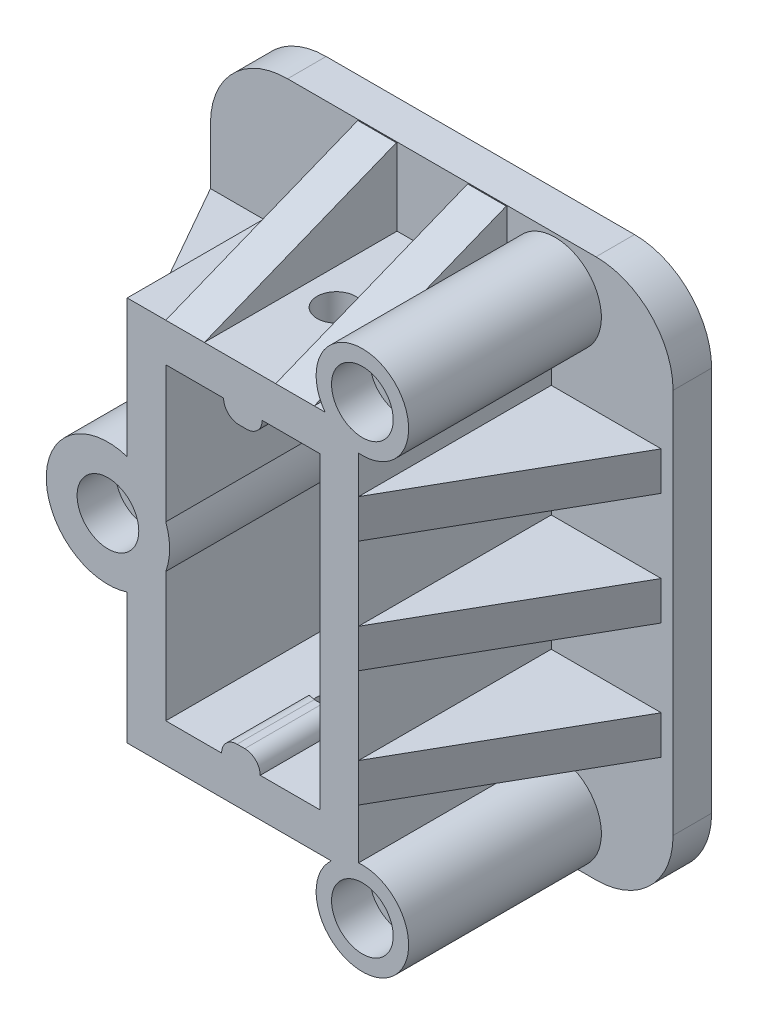
from build123d import *

# Parameters (mm, degrees)
SKETCH1_R                = 2.5
BOSS_EXTRUDE1_DEPTH      = 5
SKETCH3_W                = 20
SKETCH3_H                = 40
BOSS_EXTRUDE5_DEPTH      = 25
CUT_EXTRUDE2_DEPTH       = 75.20598847
CUT_EXTRUDE2_DEPTH_BACK  = 75.20598847
CUT_EXTRUDE_THIN13_DEPTH = 75.484252037
SKETCH8_W                = 5
SKETCH8_H                = 25
BOSS_EXTRUDE6_DEPTH      = 2
FILLET3_R                = 2
SKETCH9_W                = 5
SKETCH9_H                = 25
BOSS_EXTRUDE7_DEPTH      = 2
FILLET4_R                = 2
SKETCH11_R               = 4.5
CUT_EXTRUDE4_DEPTH       = 25
SKETCH12_R               = 6
SKETCH12_R_2             = 8
BOSS_EXTRUDE8_DEPTH      = 25
SKETCH13_R               = 2.5
CUT_EXTRUDE5_DEPTH       = 28
SKETCH14_R               = 4
CUT_EXTRUDE6_DEPTH       = 5
CUT_EXTRUDE7_DEPTH       = 18
CUT_EXTRUDE7_DEPTH_BACK  = 70
SKETCH15_R               = 2.5


with BuildPart() as part:
    # Sketch1 → Boss-Extrude1 (new body)
    with BuildSketch(Plane.XY):
        with BuildLine():
            Line((-33.639154819, 54.619565217), (6.360845181, 54.619565217))
            ThreePointArc((6.360845181, 54.619565217), (13.431912992, 51.690633029), (16.360845181, 44.619565217))
            Line((16.360845181, 44.619565217), (16.360845181, -5.380434783))
            ThreePointArc((16.360845181, -5.380434783), (13.431912992, -12.451502594), (6.360845181, -15.380434783))
            Line((6.360845181, -15.380434783), (-33.639154819, -15.380434783))
            ThreePointArc((-33.639154819, -15.380434783), (-40.710222631, -12.451502594), (-43.639154819, -5.380434783))
            Line((-43.639154819, -5.380434783), (-43.639154819, 44.619565217))
            ThreePointArc((-43.639154819, 44.619565217), (-40.710222631, 51.690633029), (-33.639154819, 54.619565217))
        make_face()
        with Locations((1.061250856, 48.159869042)):
            Circle(SKETCH1_R, mode=Mode.SUBTRACT)
        with Locations(Location((1.061250856, -9.840130958, 0), (0, 0, 180))):
            Circle(SKETCH1_R, mode=Mode.SUBTRACT)
        with Locations((-31.938749144, 19.159869042)):
            Circle(SKETCH1_R, mode=Mode.SUBTRACT)
    extrude(amount=BOSS_EXTRUDE1_DEPTH)

    # Sketch3 → Boss-Extrude5 (add)
    with BuildSketch(Plane.XY.offset(5)):
        Polygon((-24.438749144, 44.600432852), (-29.438749144, 44.600432852), (-29.438749144, 37.28199121), (-43.639154819, 37.28199121), (-43.639154819, 32.28199121), (-29.438749144, 32.28199121), (-29.438749144, 7.637328911), (-43.639154819, 7.637328911), (-43.639154819, 2.637328911), (-29.438749144, 2.637328911), (-29.438749144, -5.399567148), (-24.438749144, -5.399567148), (-24.438749144, -15.380434783), (-19.438749144, -15.380434783), (-19.438749144, -5.399567148), (-10.184597354, -5.399567148), (-10.184597354, -15.380434783), (-5.184597354, -15.380434783), (-5.184597354, -5.399567148), (0.561250856, -5.399567148), (0.561250856, 2.637328911), (14.825245568, 2.637328911), (14.825245568, 7.637328911), (0.561250856, 7.637328911), (0.561250856, 17.719700958), (14.825245568, 17.719700958), (14.825245568, 22.719700958), (0.561250856, 22.719700958), (0.561250856, 32.28199121), (14.825245568, 32.28199121), (14.825245568, 37.28199121), (0.561250856, 37.28199121), (0.561250856, 44.600432852), (-5.184597354, 44.600432852), (-5.184597354, 54.581300487), (-10.184597354, 54.581300487), (-10.184597354, 44.600432852), (-19.438749144, 44.600432852), (-19.438749144, 54.581300487), (-24.438749144, 54.581300487), align=None)
        with Locations((-14.438749144, 19.600432852)):
            Rectangle(SKETCH3_W, SKETCH3_H, mode=Mode.SUBTRACT)
    extrude(amount=BOSS_EXTRUDE5_DEPTH)

    # Sketch5 → Cut-Extrude2 (cut, two sides: drawn at the far end of the back side and taken through both)
    with BuildSketch(Plane.XZ.offset(-2.637328911).offset(-CUT_EXTRUDE2_DEPTH_BACK)):
        Polygon((-43.639154819, 30), (-43.639154819, 5), (-29.438749144, 30), align=None)
        Polygon((14.825245568, 30), (0.561250856, 30), (14.825245568, 5), align=None)
    extrude(amount=CUT_EXTRUDE2_DEPTH + CUT_EXTRUDE2_DEPTH_BACK, mode=Mode.SUBTRACT)

    # Sketch7 → Cut-Extrude-Thin13 (cut, through all)
    with BuildSketch(Plane.ZY.offset(24.438749144)):
        Polygon((30, 44.600432852), (5, 54.619565217), (8.72002984, 63.901880553), (33.72002984, 53.882748188), align=None)
        Polygon((5, -15.380434783), (30, -5.399567148), (33.707778838, -14.686782882), (8.707778838, -24.667650517), align=None)
    extrude(amount=-CUT_EXTRUDE_THIN13_DEPTH, mode=Mode.SUBTRACT)

    # Sketch8 → Boss-Extrude6 (add)
    with BuildSketch(Plane.XZ.offset(-39.600432852)):
        with Locations((-14.438749144, 17.5)):
            Rectangle(SKETCH8_W, SKETCH8_H)
    extrude(amount=BOSS_EXTRUDE6_DEPTH)

    # Fillet3
    fillet3_edges = [part.edges().sort_by_distance(p)[0] for p in [
        (-16.938749144, 37.600432852, 17.5),
        (-11.938749144, 37.600432852, 17.5),
    ]]
    fillet(fillet3_edges, radius=FILLET3_R - 0.0001)  # a hair under: the kernel refuses the full size

    # Sketch9 → Boss-Extrude7 (add)
    with BuildSketch(Plane(origin=(0, -0.399567148, 0), x_dir=(1, 0, 0), z_dir=(0, 1, 0))):
        with Locations((-14.690486301, -17.5)):
            Rectangle(SKETCH9_W, SKETCH9_H)
    extrude(amount=BOSS_EXTRUDE7_DEPTH)

    # Fillet4
    fillet4_edges = [part.edges().sort_by_distance(p)[0] for p in [
        (-12.190486301, 1.600432852, 17.5),
        (-17.190486301, 1.600432852, 17.5),
    ]]
    fillet(fillet4_edges, radius=FILLET4_R - 0.0001)  # a hair under: the kernel refuses the full size

    # Sketch11 → Cut-Extrude4 (cut)
    with BuildSketch(Plane.XY.offset(30)):
        with Locations((-31.938749144, 19.159869042)):
            Circle(SKETCH11_R)
    extrude(amount=-CUT_EXTRUDE4_DEPTH, mode=Mode.SUBTRACT)

    # Sketch12 → Boss-Extrude8 (add)
    with BuildSketch(Plane.XY.offset(5)):
        with Locations((1.061250856, 48.159869042)):
            Circle(SKETCH12_R)
        with Locations((1.061250856, -9.840130958)):
            Circle(SKETCH12_R)
        with Locations((-31.938749144, 19.159869042)):
            Circle(SKETCH12_R_2)
    extrude(amount=BOSS_EXTRUDE8_DEPTH)

    # Sketch13 → Cut-Extrude5 (cut)
    with BuildSketch(Plane(origin=(0, 0, 0), x_dir=(-1, 0, 0), z_dir=(0, 0, -1))):
        with Locations((31.938749144, 19.159869042)):
            Circle(SKETCH13_R)
        with Locations((-1.061250856, -9.840130958)):
            Circle(SKETCH13_R)
        with Locations((-1.061250856, 48.159869042)):
            Circle(SKETCH13_R)
    extrude(amount=-CUT_EXTRUDE5_DEPTH, mode=Mode.SUBTRACT)

    # Sketch14 → Cut-Extrude6 (cut)
    with BuildSketch(Plane.XY.offset(30)):
        with Locations((-31.938749144, 19.159869042)):
            Circle(SKETCH14_R)
        with Locations((1.061250856, 48.159869042)):
            Circle(SKETCH14_R)
        with Locations((1.061250856, -9.840130958)):
            Circle(SKETCH14_R)
    extrude(amount=-CUT_EXTRUDE6_DEPTH, mode=Mode.SUBTRACT)

    # Sketch15 → Cut-Extrude7 (cut, two sides: drawn at the far end of the back side and taken through both)
    with BuildSketch(Plane(origin=(0, 44.600432852, 0), x_dir=(1, 0, 0), z_dir=(0, 1, 0)).offset(-CUT_EXTRUDE7_DEPTH_BACK)):
        with Locations(Location((-14.811673249, -17.5, 0), (0, 0, 75.612724185))):
            Circle(SKETCH15_R)
    extrude(amount=CUT_EXTRUDE7_DEPTH + CUT_EXTRUDE7_DEPTH_BACK, mode=Mode.SUBTRACT)


solid = part.part
